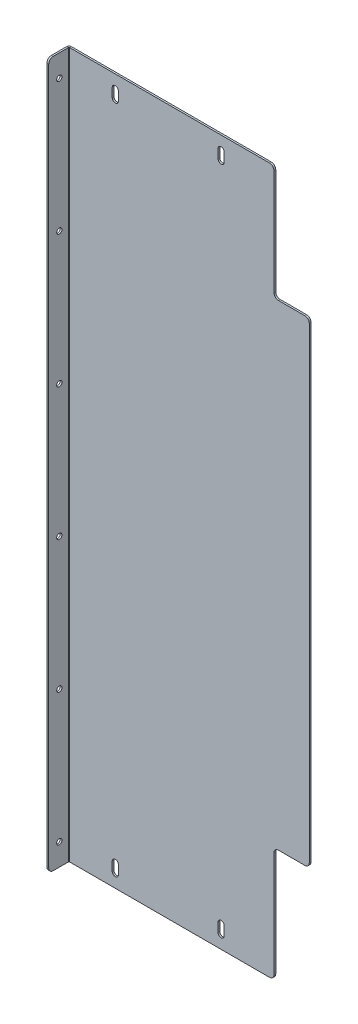
from build123d import *

# Parameters (mm, degrees)
SKETCH_1_W                       = 550
SKETCH_1_H                       = 800
SM_BASE_FLANGE_1_DEPTH           = 2
SKETCH_6_W                       = 40
SKETCH_6_H                       = 130
CUT_EXTRUDE_1_DEPTH              = 10
FILLET_1_R                       = 5
SKETCH_7_W                       = 1
SKETCH_7_H                       = 845.505579408
CUT_EXTRUDE_2_DEPTH              = 10
SKETCH_8_W                       = 316.431651149
SKETCH_8_H                       = 807.863383274
CUT_EXTRUDE_3_DEPTH              = 10
SM_EDGE_FLANGE_1_STRIP_W         = 9.4732
SM_EDGE_FLANGE_1_STRIP_H         = 2
SM_EDGE_FLANGE_1_STRIP_CUT_DEPTH = 800
SM_EDGE_FLANGE_1_DEPTH           = 800
FILLET_2_R                       = 5
CUT_EXTRUDE_4_DEPTH              = 10
SKETCH_13_R                      = 3
CUT_EXTRUDE_5_DEPTH              = 10
PATTERN_LINEAR_1_COUNT           = 6
PATTERN_LINEAR_1_PITCH           = 150


# Sheet-metal steps are written as plain solids
with BuildPart() as part:
    # Sketch 1 → 基体-法兰1 (new body)
    with BuildSketch(Plane.XY):
        Rectangle(SKETCH_1_W, SKETCH_1_H)
    extrude(amount=-SM_BASE_FLANGE_1_DEPTH)

    # 草图6 → 切除-拉伸1 (cut)
    with BuildSketch(Plane.XY):
        with Locations((255, 335)):
            Rectangle(SKETCH_6_W, SKETCH_6_H)
        with Locations((255, -335)):
            Rectangle(SKETCH_6_W, SKETCH_6_H)
    extrude(amount=-CUT_EXTRUDE_1_DEPTH, mode=Mode.SUBTRACT)

    # 圆角1
    fillet_1_edges = [part.edges().sort_by_distance(p)[0] for p in [
        (275, 270, -1),
        (235, 270, -1),
        (235, 400, -1),
        (275, -270, -1),
        (235, -400, -1),
        (235, -270, -1),
        (-275, 400, -1),
        (-275, -400, -1),
    ]]
    fillet(fillet_1_edges, radius=FILLET_1_R)

    # 草图7 → 切除-拉伸2 (cut)
    with BuildSketch(Plane.XY):
        Rectangle(SKETCH_7_W, SKETCH_7_H)
    extrude(amount=-CUT_EXTRUDE_2_DEPTH, mode=Mode.SUBTRACT)


with BuildPart() as cut_extrude_2_piece_1:
    # of the separate pieces the step leaves, piece 1, a body of its own (cut_extrude_2_pieces)
    add(part.part.solids().sort_by_distance((-0.5, -400, 0))[0])

    # 草图8 → 切除-拉伸3 (cut)
    with BuildSketch(Plane.XY):
        with Locations((-158.715825575, -3.931691637)):
            Rectangle(SKETCH_8_W, SKETCH_8_H)
    extrude(amount=-CUT_EXTRUDE_3_DEPTH, mode=Mode.SUBTRACT)


with BuildPart() as cut_extrude_2_piece_2:
    # of the separate pieces the step leaves, piece 2, a body of its own (cut_extrude_2_pieces)
    add(part.part.solids().sort_by_distance((230, -400, 0))[0])

    # 边线-法兰1 strip (across the edge) → 边线-法兰1 strip cut (cut)
    with BuildSketch(Plane(origin=(0.5, 400, 0), x_dir=(1, 0, 0), z_dir=(0, -1, 0))):
        with Locations((-2, -1)):
            Rectangle(SM_EDGE_FLANGE_1_STRIP_W, SM_EDGE_FLANGE_1_STRIP_H)
    extrude(amount=SM_EDGE_FLANGE_1_STRIP_CUT_DEPTH, mode=Mode.SUBTRACT)

    # 边线-法兰1 section (across the edge) → 边线-法兰1 (add)
    with BuildSketch(Plane(origin=(0.5, 400, 0), x_dir=(1, 0, 0), z_dir=(0, -1, 0))):
        with BuildLine():
            Line((0, 0.7366), (0, 23))
            Line((0, 23), (2, 23))
            Line((2, 23), (2, 0.7366))
            ThreePointArc((2, 0.7366), (2.215745145, 0.215745145), (2.7366, 0))
            Line((2.7366, 0), (2.7366, -2))
            ThreePointArc((2.7366, -2), (0.801531583, -1.198468417), (0, 0.7366))
        make_face()
    extrude(amount=SM_EDGE_FLANGE_1_DEPTH)

    # 圆角2
    fillet_2_edges = [cut_extrude_2_piece_2.edges().sort_by_distance(p)[0] for p in [
        (1.5, 400, 23),
        (1.5, -400, 23),
    ]]
    fillet(fillet_2_edges, radius=FILLET_2_R)

    # 草图12 → 切除-拉伸4 (cut)
    with BuildSketch(Plane.XY):
        with BuildLine():
            Line((51.5, 375), (51.5, 385))
            ThreePointArc((51.5, 385), (55, 388.5), (58.5, 385))
            Line((58.5, 385), (58.5, 375))
            ThreePointArc((58.5, 375), (55, 371.5), (51.5, 375))
        make_face()
        with BuildLine():
            Line((171.5, 375), (171.5, 385))
            ThreePointArc((171.5, 385), (175, 388.5), (178.5, 385))
            Line((178.5, 385), (178.5, 375))
            ThreePointArc((178.5, 375), (175, 371.5), (171.5, 375))
        make_face()
        with BuildLine():
            Line((51.5, -385), (51.5, -375))
            ThreePointArc((51.5, -375), (55, -371.5), (58.5, -375))
            Line((58.5, -375), (58.5, -385))
            ThreePointArc((58.5, -385), (55, -388.5), (51.5, -385))
        make_face()
        with BuildLine():
            Line((171.5, -385), (171.5, -375))
            ThreePointArc((171.5, -375), (175, -371.5), (178.5, -375))
            Line((178.5, -375), (178.5, -385))
            ThreePointArc((178.5, -385), (175, -388.5), (171.5, -385))
        make_face()
    extrude(amount=-CUT_EXTRUDE_4_DEPTH, mode=Mode.SUBTRACT)

    # 草图13 → 切除-拉伸5 (cut)
    with BuildSketch(Plane(origin=(2.5, 0, 0), x_dir=(0, 0, -1), z_dir=(1, 0, 0))):
        with Locations((-11, -375)):
            Circle(SKETCH_13_R)
    cut_extrude_5 = extrude(amount=-CUT_EXTRUDE_5_DEPTH, mode=Mode.SUBTRACT)

    # 阵列(线性)1: 切除-拉伸5 ×6
    with Locations(*[(0, i * PATTERN_LINEAR_1_PITCH, 0) for i in range(1, PATTERN_LINEAR_1_COUNT)]):
        add(cut_extrude_5, mode=Mode.SUBTRACT)


solid = cut_extrude_2_piece_2.part
